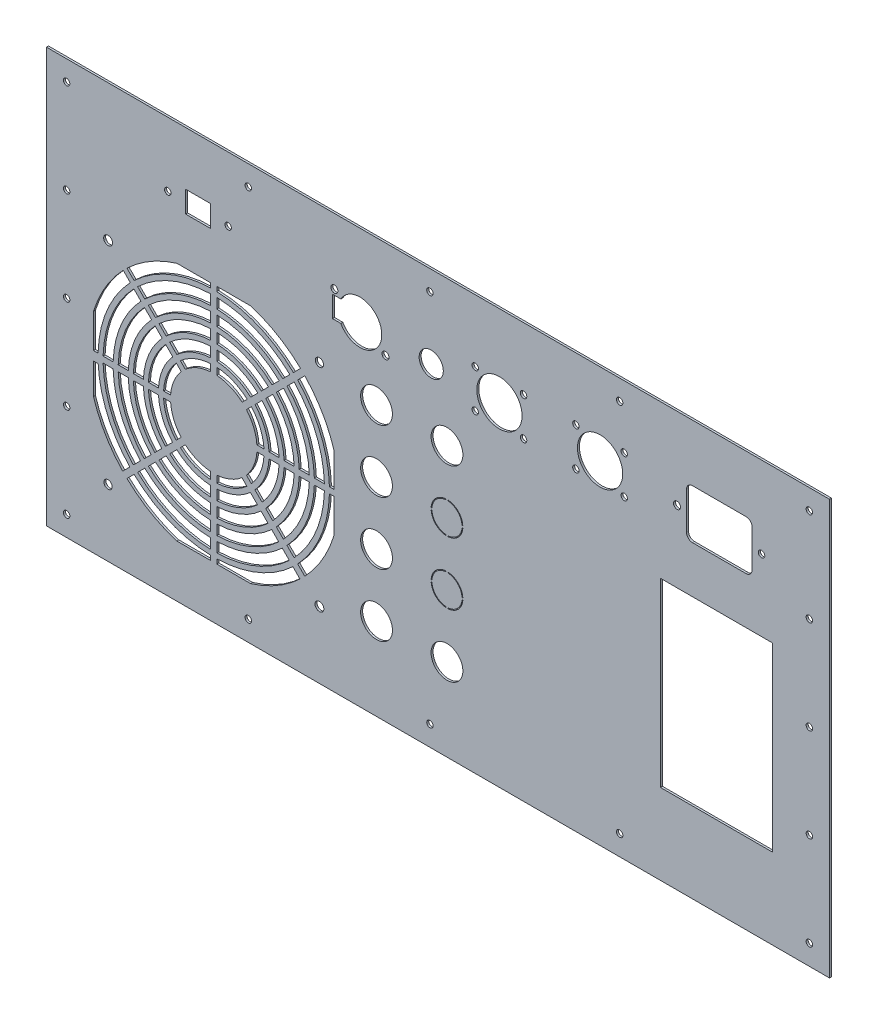
from build123d import *

# Parameters (mm, degrees)
SZKIC1_W                    = 397
SZKIC1_H                    = 206
DODANIE_WYCI_GNI_CIE1_DEPTH = 1
SZKIC2_R                    = 2.2
SZKIC2_R_2                  = 2.047520336
WYTNIJ_WYCI_GNI_CIE1_DEPTH  = 402.486583316
SZKIC3_R                    = 7.9
WYTNIJ_WYCI_GNI_CIE2_DEPTH  = 402.486583316
WYTNIJ_WYCI_GNI_CIE3_DEPTH  = 402.486583316
SZKIC5_R                    = 6
WYTNIJ_WYCI_GNI_CIE4_DEPTH  = 402.486583316
SZKIC7_R                    = 11.25
SZKIC7_R_2                  = 1.6
WYTNIJ_WYCI_GNI_CIE5_DEPTH  = 402.486583316
SZKIC10_R                   = 1.75
SZKIC10_R_2                 = 1.6
WYTNIJ_WYCI_GNI_CIE6_DEPTH  = 402.486583316
SZKIC11_W                   = 55.75
SZKIC11_H                   = 90
WYTNIJ_WYCI_GNI_CIE7_DEPTH  = 402.486583316
SZKIC12_R                   = 1.6
SZKIC12_W                   = 10.7
SZKIC12_H                   = 12.3
SZKIC12_W_2                 = 12.3
SZKIC12_H_2                 = 10.7
WYTNIJ_WYCI_GNI_CIE8_DEPTH  = 402.486583316
SZKIC13_R                   = 1.6
WYTNIJ_WYCI_GNI_CIE9_DEPTH  = 402.486583316
SZKIC14_W                   = 1
SZKIC14_H                   = 206
WYTNIJ_WYCI_GNI_CIE10_DEPTH = 8
DODANIE_WYCI_GNI_CIE2_START = -1
SZKIC15_R                   = 1.6
SZKIC15_W                   = 10.7
SZKIC15_H                   = 12.3
DODANIE_WYCI_GNI_CIE2_DEPTH = 1
SZKIC16_R                   = 1.75
WYTNIJ_WYCI_GNI_CIE11_DEPTH = 1
DODANIE_WYCI_GNI_CIE3_DEPTH = 1


with BuildPart() as part:
    # Szkic1 → Dodanie-wyciągnięcie1 (new body)
    with BuildSketch(Plane.XY):
        with Locations((-163.098523744, 71.461984995)):
            Rectangle(SZKIC1_W, SZKIC1_H)
    extrude(amount=DODANIE_WYCI_GNI_CIE1_DEPTH)

    # Szkic2 → Wytnij-wyciągnięcie1 (cut, through all)
    with BuildSketch(Plane.XY.offset(1)):
        with Locations((-323.009643383, 106.603512307)):
            Circle(SZKIC2_R)
        with Locations((-218.005397687, 106.607758003)):
            Circle(SZKIC2_R_2)
        with Locations((-218.009643383, 1.603512307)):
            Circle(SZKIC2_R)
        with Locations((-323.009643383, 1.603512307)):
            Circle(SZKIC2_R_2)
        with BuildLine():
            Line((-330.259643383, 72.438928855), (-330.259643383, 55.603512307))
            Line((-330.259643383, 55.603512307), (-327.990074836, 55.603512307))
            ThreePointArc((-327.990074836, 55.603512307), (-323.561956957, 76.277867416), (-311.960649805, 93.954033841))
            Line((-311.960649805, 93.954033841), (-315.474560497, 97.513260393))
            ThreePointArc((-315.474560497, 97.513260393), (-324.347213834, 85.848842797), (-330.259643383, 72.438928855))
        make_face()
        with BuildLine():
            Line((-272.009643383, 113.853512307), (-288.845059931, 113.853512307))
            ThreePointArc((-288.845059931, 113.853512307), (-302.082351584, 108.042497251), (-313.63042728, 99.345616547))
            Line((-313.63042728, 99.345616547), (-310.093786077, 95.808975344))
            ThreePointArc((-310.093786077, 95.808975344), (-292.513940744, 107.226585426), (-272.009643383, 111.583943759))
            Line((-272.009643383, 111.583943759), (-272.009643383, 113.853512307))
        make_face()
        with BuildLine():
            Line((-210.759643383, 72.438928855), (-210.759643383, 55.603512307))
            Line((-210.759643383, 55.603512307), (-213.02921193, 55.603512307))
            ThreePointArc((-213.02921193, 55.603512307), (-217.386570264, 76.107809668), (-228.804180346, 93.687655001))
            Line((-228.804180346, 93.687655001), (-225.267539143, 97.224296204))
            ThreePointArc((-225.267539143, 97.224296204), (-216.570658438, 85.676220507), (-210.759643383, 72.438928855))
        make_face()
        with BuildLine():
            Line((-330.259643383, 51.103512307), (-327.931329182, 51.103512307))
            ThreePointArc((-327.931329182, 51.103512307), (-323.340957803, 31.407648879), (-312.215106421, 14.519369613))
            Line((-312.215106421, 14.519369613), (-315.751747624, 10.98272841))
            ThreePointArc((-315.751747624, 10.98272841), (-324.448628328, 22.530804106), (-330.259643383, 35.768095758))
            Line((-330.259643383, 35.768095758), (-330.259643383, 51.103512307))
        make_face()
        with BuildLine():
            Line((-269.009643383, 113.853512307), (-269.009643383, 111.583943759))
            ThreePointArc((-269.009643383, 111.583943759), (-248.505346022, 107.226585426), (-230.925500689, 95.808975344))
            Line((-230.925500689, 95.808975344), (-227.388859486, 99.345616547))
            ThreePointArc((-227.388859486, 99.345616547), (-238.936935182, 108.042497251), (-252.174226835, 113.853512307))
            Line((-252.174226835, 113.853512307), (-269.009643383, 113.853512307))
        make_face()
        with BuildLine():
            Line((-210.759643383, 35.768095758), (-210.759643383, 52.603512307))
            Line((-210.759643383, 52.603512307), (-213.02921193, 52.603512307))
            ThreePointArc((-213.02921193, 52.603512307), (-217.386570264, 32.099214946), (-228.804180346, 14.519369613))
            Line((-228.804180346, 14.519369613), (-225.267539143, 10.98272841))
            ThreePointArc((-225.267539143, 10.98272841), (-216.570658438, 22.530804106), (-210.759643383, 35.768095758))
        make_face()
        with BuildLine():
            Line((-252.174226835, -5.646487693), (-269.009643383, -5.646487693))
            Line((-269.009643383, -5.646487693), (-269.009643383, -3.376919146))
            ThreePointArc((-269.009643383, -3.376919146), (-248.675629564, 0.910224755), (-231.193504271, 12.145304465))
            Line((-231.193504271, 12.145304465), (-227.679593579, 8.586077913))
            ThreePointArc((-227.679593579, 8.586077913), (-239.10988145, 0.063666354), (-252.174226835, -5.646487693))
        make_face()
        with BuildLine():
            Line((-272.009643383, -5.646487693), (-288.845059931, -5.646487693))
            ThreePointArc((-288.845059931, -5.646487693), (-302.082351584, 0.164527362), (-313.63042728, 8.861408066))
            Line((-313.63042728, 8.861408066), (-310.093786077, 12.398049269))
            ThreePointArc((-310.093786077, 12.398049269), (-292.513940744, 0.980439187), (-272.009643383, -3.376919146))
            Line((-272.009643383, -3.376919146), (-272.009643383, -5.646487693))
        make_face()
        with BuildLine():
            Line((-272.009643383, 32.655901717), (-272.009643383, 29.14855288))
            ThreePointArc((-272.009643383, 29.14855288), (-280.076729192, 31.006523994), (-287.094804246, 35.3970311))
            Line((-287.094804246, 35.3970311), (-284.614734099, 37.877101247))
            ThreePointArc((-284.614734099, 37.877101247), (-278.737337179, 34.240102358), (-272.009643383, 32.655901717))
        make_face()
        with BuildLine():
            Line((-269.009643383, 32.655901717), (-269.009643383, 29.14855288))
            ThreePointArc((-269.009643383, 29.14855288), (-261.016593896, 30.97599598), (-254.044668278, 35.29116012))
            Line((-254.044668278, 35.29116012), (-256.508798651, 37.787068246))
            ThreePointArc((-256.508798651, 37.787068246), (-262.345620825, 34.213848266), (-269.009643383, 32.655901717))
        make_face()
        with BuildLine():
            Line((-269.009643383, 26.644451871), (-269.009643383, 21.638146145))
            ThreePointArc((-269.009643383, 21.638146145), (-258.16867905, 24.037741082), (-248.768141133, 29.946586179))
            Line((-248.768141133, 29.946586179), (-252.285381809, 33.509185659))
            ThreePointArc((-252.285381809, 33.509185659), (-260.067288948, 28.663244347), (-269.009643383, 26.644451871))
        make_face()
        with BuildLine():
            Line((-272.009643383, 79.058471733), (-272.009643383, 75.551122896))
            ThreePointArc((-272.009643383, 75.551122896), (-278.737337179, 73.966922256), (-284.614734099, 70.329923366))
            Line((-284.614734099, 70.329923366), (-287.094804246, 72.809993513))
            ThreePointArc((-287.094804246, 72.809993513), (-280.076729192, 77.200500619), (-272.009643383, 79.058471733))
        make_face()
        with BuildLine():
            Line((-272.009643383, 26.644451871), (-272.009643383, 21.638146145))
            ThreePointArc((-272.009643383, 21.638146145), (-282.946854935, 24.0774275), (-292.405463778, 30.086371568))
            Line((-292.405463778, 30.086371568), (-288.86547105, 33.626364296))
            ThreePointArc((-288.86547105, 33.626364296), (-281.033437773, 28.696825162), (-272.009643383, 26.644451871))
        make_face()
        with BuildLine():
            Line((-272.009643383, 19.135669937), (-272.009643383, 14.131647201))
            ThreePointArc((-272.009643383, 14.131647201), (-285.816980678, 17.148331006), (-297.713360084, 24.778475262))
            Line((-297.713360084, 24.778475262), (-294.174981675, 28.316853672))
            ThreePointArc((-294.174981675, 28.316853672), (-283.903563516, 21.767728669), (-272.009643383, 19.135669937))
        make_face()
        with BuildLine():
            Line((-269.009643383, 19.135669937), (-269.009643383, 14.131647201))
            ThreePointArc((-269.009643383, 14.131647201), (-255.320764204, 17.099486184), (-243.494359454, 24.604793111))
            Line((-243.494359454, 24.604793111), (-247.009996187, 28.165767962))
            ThreePointArc((-247.009996187, 28.165767962), (-257.219374102, 21.724989449), (-269.009643383, 19.135669937))
        make_face()
        with BuildLine():
            Line((-272.009643383, 11.629991143), (-272.009643383, 6.627202425))
            ThreePointArc((-272.009643383, 6.627202425), (-288.687106421, 10.219234512), (-303.019803875, 19.472031472))
            Line((-303.019803875, 19.472031472), (-299.482298047, 23.009537299))
            ThreePointArc((-299.482298047, 23.009537299), (-286.773689259, 14.838632175), (-272.009643383, 11.629991143))
        make_face()
        with BuildLine():
            Line((-269.009643383, 11.629991143), (-269.009643383, 6.627202425))
            ThreePointArc((-269.009643383, 6.627202425), (-252.472849358, 10.161231286), (-238.222020954, 19.264461833))
            Line((-238.222020954, 19.264461833), (-241.736790714, 22.824558531))
            ThreePointArc((-241.736790714, 22.824558531), (-254.371459256, 14.786734551), (-269.009643383, 11.629991143))
        make_face()
        with BuildLine():
            Line((-272.009643383, 4.126017371), (-272.009643383, -0.876029343))
            ThreePointArc((-272.009643383, -0.876029343), (-291.557232163, 3.290138018), (-308.325389938, 14.166445408))
            Line((-308.325389938, 14.166445408), (-304.788408787, 17.703426559))
            ThreePointArc((-304.788408787, 17.703426559), (-289.643815001, 7.909535681), (-272.009643383, 4.126017371))
        make_face()
        with BuildLine():
            Line((-269.009643383, 4.126017371), (-269.009643383, -0.876029343))
            ThreePointArc((-269.009643383, -0.876029343), (-249.624934512, 3.222976388), (-232.950534669, 13.92499376))
            Line((-232.950534669, 13.92499376), (-236.464783125, 17.484562431))
            ThreePointArc((-236.464783125, 17.484562431), (-251.52354441, 7.848479653), (-269.009643383, 4.126017371))
        make_face()
        with BuildLine():
            Line((-269.009643383, 79.058471733), (-269.009643383, 75.551122896))
            ThreePointArc((-269.009643383, 75.551122896), (-262.281949587, 73.966922256), (-256.404552667, 70.329923366))
            Line((-256.404552667, 70.329923366), (-253.92448252, 72.809993513))
            ThreePointArc((-253.92448252, 72.809993513), (-260.942557574, 77.200500619), (-269.009643383, 79.058471733))
        make_face()
        with BuildLine():
            Line((-272.009643383, 109.083053956), (-272.009643383, 104.081007242))
            ThreePointArc((-272.009643383, 104.081007242), (-289.643815001, 100.297488932), (-304.788408787, 90.503598054))
            Line((-304.788408787, 90.503598054), (-308.325389938, 94.040579205))
            ThreePointArc((-308.325389938, 94.040579205), (-291.557232163, 104.916886595), (-272.009643383, 109.083053956))
        make_face()
        with BuildLine():
            Line((-269.009643383, 109.083053956), (-269.009643383, 104.081007242))
            ThreePointArc((-269.009643383, 104.081007242), (-251.375471765, 100.297488932), (-236.23087798, 90.503598054))
            Line((-236.23087798, 90.503598054), (-232.693896828, 94.040579205))
            ThreePointArc((-232.693896828, 94.040579205), (-249.462054603, 104.916886595), (-269.009643383, 109.083053956))
        make_face()
        with BuildLine():
            Line((-272.009643383, 101.579822188), (-272.009643383, 96.57703347))
            ThreePointArc((-272.009643383, 96.57703347), (-286.773689259, 93.368392438), (-299.482298047, 85.197487314))
            Line((-299.482298047, 85.197487314), (-303.019803875, 88.734993142))
            ThreePointArc((-303.019803875, 88.734993142), (-288.687106421, 97.987790101), (-272.009643383, 101.579822188))
        make_face()
        with BuildLine():
            Line((-269.009643383, 101.579822188), (-269.009643383, 96.57703347))
            ThreePointArc((-269.009643383, 96.57703347), (-254.245597508, 93.368392438), (-241.53698872, 85.197487314))
            Line((-241.53698872, 85.197487314), (-237.999482892, 88.734993142))
            ThreePointArc((-237.999482892, 88.734993142), (-252.332180346, 97.987790101), (-269.009643383, 101.579822188))
        make_face()
        with BuildLine():
            Line((-272.009643383, 94.075377412), (-272.009643383, 89.071354676))
            ThreePointArc((-272.009643383, 89.071354676), (-283.903563516, 86.439295944), (-294.174981675, 79.890170941))
            Line((-294.174981675, 79.890170941), (-297.713360084, 83.428549351))
            ThreePointArc((-297.713360084, 83.428549351), (-285.816980678, 91.058693607), (-272.009643383, 94.075377412))
        make_face()
        with BuildLine():
            Line((-269.009643383, 94.075377412), (-269.009643383, 89.071354676))
            ThreePointArc((-269.009643383, 89.071354676), (-257.11572325, 86.439295944), (-246.844305092, 79.890170941))
            Line((-246.844305092, 79.890170941), (-243.305926682, 83.428549351))
            ThreePointArc((-243.305926682, 83.428549351), (-255.202306089, 91.058693607), (-269.009643383, 94.075377412))
        make_face()
        with BuildLine():
            Line((-272.009643383, 86.568878468), (-272.009643383, 81.562572742))
            ThreePointArc((-272.009643383, 81.562572742), (-281.033437773, 79.510199451), (-288.86547105, 74.580660317))
            Line((-288.86547105, 74.580660317), (-292.405463778, 78.120653045))
            ThreePointArc((-292.405463778, 78.120653045), (-282.946854935, 84.129597113), (-272.009643383, 86.568878468))
        make_face()
        with BuildLine():
            Line((-269.009643383, 86.568878468), (-269.009643383, 81.562572742))
            ThreePointArc((-269.009643383, 81.562572742), (-259.985848993, 79.510199451), (-252.153815716, 74.580660317))
            Line((-252.153815716, 74.580660317), (-248.613822988, 78.120653045))
            ThreePointArc((-248.613822988, 78.120653045), (-258.072431831, 84.129597113), (-269.009643383, 86.568878468))
        make_face()
        with BuildLine():
            Line((-320.487138318, 55.603512307), (-325.489185033, 55.603512307))
            ThreePointArc((-325.489185033, 55.603512307), (-321.255334627, 75.31376502), (-310.203619407, 92.174344546))
            Line((-310.203619407, 92.174344546), (-306.689370951, 88.614775875))
            ThreePointArc((-306.689370951, 88.614775875), (-316.642089969, 73.385560227), (-320.487138318, 55.603512307))
        make_face()
        with BuildLine():
            Line((-320.487138318, 52.603512307), (-325.489185033, 52.603512307))
            ThreePointArc((-325.489185033, 52.603512307), (-321.323017671, 33.055923526), (-310.446710282, 16.287765751))
            Line((-310.446710282, 16.287765751), (-306.90972913, 19.824746903))
            ThreePointArc((-306.90972913, 19.824746903), (-316.703620009, 34.969340688), (-320.487138318, 52.603512307))
        make_face()
        with BuildLine():
            Line((-312.983164546, 55.603512307), (-317.985953265, 55.603512307))
            ThreePointArc((-317.985953265, 55.603512307), (-314.33546764, 72.421457831), (-304.932133122, 86.834876473))
            Line((-304.932133122, 86.834876473), (-301.417363362, 83.274779775))
            ThreePointArc((-301.417363362, 83.274779775), (-309.722222981, 70.493253039), (-312.983164546, 55.603512307))
        make_face()
        with BuildLine():
            Line((-312.983164546, 52.603512307), (-317.985953265, 52.603512307))
            ThreePointArc((-317.985953265, 52.603512307), (-314.393921177, 35.926049269), (-305.141124218, 21.593351815))
            Line((-305.141124218, 21.593351815), (-301.60361839, 25.130857643))
            ThreePointArc((-301.60361839, 25.130857643), (-309.774523515, 37.839466431), (-312.983164546, 52.603512307))
        make_face()
        with BuildLine():
            Line((-305.477485753, 55.603512307), (-310.481508489, 55.603512307))
            ThreePointArc((-310.481508489, 55.603512307), (-307.415600652, 69.529150643), (-299.659794623, 81.494545195))
            Line((-299.659794623, 81.494545195), (-296.144157889, 77.933570343))
            ThreePointArc((-296.144157889, 77.933570343), (-302.802355993, 67.600945851), (-305.477485753, 55.603512307))
        make_face()
        with BuildLine():
            Line((-305.477485753, 52.603512307), (-310.481508489, 52.603512307))
            ThreePointArc((-310.481508489, 52.603512307), (-307.464824684, 38.796175012), (-299.834680428, 26.899795606))
            Line((-299.834680428, 26.899795606), (-296.296302018, 30.438174015))
            ThreePointArc((-296.296302018, 30.438174015), (-302.845427021, 40.709592174), (-305.477485753, 52.603512307))
        make_face()
        with BuildLine():
            Line((-297.968703819, 55.603512307), (-302.975009545, 55.603512307))
            ThreePointArc((-302.975009545, 55.603512307), (-300.495733664, 66.636843455), (-294.386012943, 76.152752127))
            Line((-294.386012943, 76.152752127), (-290.868772267, 72.590152647))
            ThreePointArc((-290.868772267, 72.590152647), (-295.882489005, 64.708638663), (-297.968703819, 55.603512307))
        make_face()
        with BuildLine():
            Line((-297.968703819, 52.603512307), (-302.975009545, 52.603512307))
            ThreePointArc((-302.975009545, 52.603512307), (-300.53572819, 41.666300755), (-294.526784121, 32.207691912))
            Line((-294.526784121, 32.207691912), (-290.986791394, 35.747684639))
            ThreePointArc((-290.986791394, 35.747684639), (-295.916330527, 43.579717917), (-297.968703819, 52.603512307))
        make_face()
        with BuildLine():
            Line((-291.957253973, 52.603512307), (-295.46460281, 52.603512307))
            ThreePointArc((-295.46460281, 52.603512307), (-293.606631696, 44.536426497), (-289.21612459, 37.518351443))
            Line((-289.21612459, 37.518351443), (-286.736054443, 39.99842159))
            ThreePointArc((-286.736054443, 39.99842159), (-290.373053332, 45.875818511), (-291.957253973, 52.603512307))
        make_face()
        with BuildLine():
            Line((-291.957253973, 55.603512307), (-295.46460281, 55.603512307))
            ThreePointArc((-295.46460281, 55.603512307), (-293.575866676, 63.744536267), (-289.109485798, 70.808178186))
            Line((-289.109485798, 70.808178186), (-286.645355425, 68.31227006))
            ThreePointArc((-286.645355425, 68.31227006), (-290.346595415, 62.394792913), (-291.957253973, 55.603512307))
        make_face()
        with BuildLine():
            Line((-245.554683956, 52.603512307), (-249.062032794, 52.603512307))
            ThreePointArc((-249.062032794, 52.603512307), (-250.646233434, 45.875818511), (-254.283232323, 39.99842159))
            Line((-254.283232323, 39.99842159), (-251.803162176, 37.518351443))
            ThreePointArc((-251.803162176, 37.518351443), (-247.41265507, 44.536426497), (-245.554683956, 52.603512307))
        make_face()
        with BuildLine():
            Line((-245.554683956, 55.603512307), (-249.062032794, 55.603512307))
            ThreePointArc((-249.062032794, 55.603512307), (-250.646233434, 62.331206102), (-254.283232323, 68.208603023))
            Line((-254.283232323, 68.208603023), (-251.803162176, 70.68867317))
            ThreePointArc((-251.803162176, 70.68867317), (-247.41265507, 63.670598116), (-245.554683956, 55.603512307))
        make_face()
        with BuildLine():
            Line((-238.044277222, 55.603512307), (-243.050582948, 55.603512307))
            ThreePointArc((-243.050582948, 55.603512307), (-245.102956239, 64.627306697), (-250.032495372, 72.459339974))
            Line((-250.032495372, 72.459339974), (-246.492502645, 75.999332701))
            ThreePointArc((-246.492502645, 75.999332701), (-240.483558577, 66.540723858), (-238.044277222, 55.603512307))
        make_face()
        with BuildLine():
            Line((-238.044277222, 52.603512307), (-243.050582948, 52.603512307))
            ThreePointArc((-243.050582948, 52.603512307), (-245.102956239, 43.579717917), (-250.032495372, 35.747684639))
            Line((-250.032495372, 35.747684639), (-246.492502645, 32.207691912))
            ThreePointArc((-246.492502645, 32.207691912), (-240.483558577, 41.666300755), (-238.044277222, 52.603512307))
        make_face()
        with BuildLine():
            Line((-230.537778278, 52.603512307), (-235.541801013, 52.603512307))
            ThreePointArc((-235.541801013, 52.603512307), (-238.173859745, 40.709592174), (-244.722984748, 30.438174015))
            Line((-244.722984748, 30.438174015), (-241.184606339, 26.899795606))
            ThreePointArc((-241.184606339, 26.899795606), (-233.554462083, 38.796175012), (-230.537778278, 52.603512307))
        make_face()
        with BuildLine():
            Line((-230.537778278, 55.603512307), (-235.541801013, 55.603512307))
            ThreePointArc((-235.541801013, 55.603512307), (-238.173859745, 67.497432439), (-244.722984748, 77.768850598))
            Line((-244.722984748, 77.768850598), (-241.184606339, 81.307229007))
            ThreePointArc((-241.184606339, 81.307229007), (-233.554462083, 69.410849601), (-230.537778278, 55.603512307))
        make_face()
        with BuildLine():
            Line((-223.033333501, 52.603512307), (-228.03612222, 52.603512307))
            ThreePointArc((-228.03612222, 52.603512307), (-231.244763251, 37.839466431), (-239.415668376, 25.130857643))
            Line((-239.415668376, 25.130857643), (-235.878162548, 21.593351815))
            ThreePointArc((-235.878162548, 21.593351815), (-226.625365589, 35.926049269), (-223.033333501, 52.603512307))
        make_face()
        with BuildLine():
            Line((-223.033333501, 55.603512307), (-228.03612222, 55.603512307))
            ThreePointArc((-228.03612222, 55.603512307), (-231.244763251, 70.367558182), (-239.415668376, 83.07616697))
            Line((-239.415668376, 83.07616697), (-235.878162548, 86.613672798))
            ThreePointArc((-235.878162548, 86.613672798), (-226.625365589, 72.280975344), (-223.033333501, 55.603512307))
        make_face()
        with BuildLine():
            Line((-215.530101734, 52.603512307), (-220.532148448, 52.603512307))
            ThreePointArc((-220.532148448, 52.603512307), (-224.315666758, 34.969340688), (-234.109557636, 19.824746903))
            Line((-234.109557636, 19.824746903), (-230.572576484, 16.287765751))
            ThreePointArc((-230.572576484, 16.287765751), (-219.696269095, 33.055923526), (-215.530101734, 52.603512307))
        make_face()
        with BuildLine():
            Line((-215.530101734, 55.603512307), (-220.532148448, 55.603512307))
            ThreePointArc((-220.532148448, 55.603512307), (-224.315666758, 73.237683925), (-234.109557636, 88.38227771))
            Line((-234.109557636, 88.38227771), (-230.572576484, 91.919258862))
            ThreePointArc((-230.572576484, 91.919258862), (-219.696269095, 75.151101087), (-215.530101734, 55.603512307))
        make_face()
    extrude(amount=-WYTNIJ_WYCI_GNI_CIE1_DEPTH, mode=Mode.SUBTRACT)

    # Szkic3 → Wytnij-wyciągnięcie2 (cut, through all)
    with BuildSketch(Plane(origin=(0, 0, 0), x_dir=(-1, 0, 0), z_dir=(0, 0, -1))):
        with Locations((189.633110243, 40.461984995)):
            Circle(SZKIC3_R)
        with Locations((189.633110243, 9.461984995)):
            Circle(SZKIC3_R)
        with Locations((154.633110243, 71.461984995)):
            Circle(SZKIC3_R)
        with Locations((189.633110243, 71.461984995)):
            Circle(SZKIC3_R)
        with Locations((154.633110243, 9.461984995)):
            Circle(SZKIC3_R)
        with Locations((154.633110243, 40.461984995)):
            Circle(SZKIC3_R)
        with Locations((154.633110243, 102.461984995)):
            Circle(SZKIC3_R)
        with Locations((189.633110243, 102.461984995)):
            Circle(SZKIC3_R)
    extrude(amount=-WYTNIJ_WYCI_GNI_CIE2_DEPTH, mode=Mode.SUBTRACT)

    # Szkic4 → Wytnij-wyciągnięcie3 (cut, through all)
    with BuildSketch(Plane(origin=(0, 0, 0), x_dir=(-1, 0, 0), z_dir=(0, 0, -1))):
        with BuildLine():
            Line((207.378372219, 139.211984957), (211.483110243, 139.211984957))
            Line((211.483110243, 139.211984957), (211.483110243, 128.711984957))
            Line((211.483110243, 128.711984957), (207.378372219, 128.711984957))
            ThreePointArc((207.378372219, 128.711984957), (187.033110243, 133.961984957), (207.378372219, 139.211984957))
        make_face()
    extrude(amount=-WYTNIJ_WYCI_GNI_CIE3_DEPTH, mode=Mode.SUBTRACT)

    # Szkic5 → Wytnij-wyciągnięcie4 (cut, through all)
    with BuildSketch(Plane(origin=(0, 0, 0), x_dir=(-1, 0, 0), z_dir=(0, 0, -1))):
        with Locations((162.463329086, 133.692146056)):
            Circle(SZKIC5_R)
    extrude(amount=-WYTNIJ_WYCI_GNI_CIE4_DEPTH, mode=Mode.SUBTRACT)

    # Szkic7 → Wytnij-wyciągnięcie5 (cut, through all)
    with BuildSketch(Plane(origin=(0, 0, 0), x_dir=(-1, 0, 0), z_dir=(0, 0, -1))):
        with Locations((128.57994213, 133.961858881)):
            Circle(SZKIC7_R)
        with Locations((78.57987055, 133.961984995)):
            Circle(SZKIC7_R)
        with Locations((140.57994213, 143.461858881)):
            Circle(SZKIC7_R_2)
        with Locations((140.57994213, 124.461858881)):
            Circle(SZKIC7_R_2)
        with Locations((116.57994213, 124.461858881)):
            Circle(SZKIC7_R_2)
        with Locations((116.57994213, 143.461858881)):
            Circle(SZKIC7_R_2)
        with Locations((90.57987055, 143.461858881)):
            Circle(SZKIC7_R_2)
        with Locations((90.57987055, 124.461858881)):
            Circle(SZKIC7_R_2)
        with Locations((66.57987055, 124.461858881)):
            Circle(SZKIC7_R_2)
        with Locations((66.57987055, 143.461858881)):
            Circle(SZKIC7_R_2)
    extrude(amount=-WYTNIJ_WYCI_GNI_CIE5_DEPTH, mode=Mode.SUBTRACT)

    # Szkic10 → Wytnij-wyciągnięcie6 (cut, through all)
    with BuildSketch(Plane(origin=(0, 0, 0), x_dir=(-1, 0, 0), z_dir=(0, 0, -1))):
        with Locations((40.348523744, 133.991984995)):
            Circle(SZKIC10_R)
        with Locations((-1.651476256, 133.991984995)):
            Circle(SZKIC10_R_2)
        with BuildLine():
            Line((32.648523744, 146.241984995), (6.048523744, 146.241984995))
            ThreePointArc((6.048523744, 146.241984995), (3.927203401, 145.363305339), (3.048523744, 143.241984995))
            Line((3.048523744, 143.241984995), (3.048523744, 124.741984995))
            ThreePointArc((3.048523744, 124.741984995), (3.927203401, 122.620664652), (6.048523744, 121.741984995))
            Line((6.048523744, 121.741984995), (32.648523744, 121.741984995))
            ThreePointArc((32.648523744, 121.741984995), (34.769844088, 122.620664652), (35.648523744, 124.741984995))
            Line((35.648523744, 124.741984995), (35.648523744, 143.241984995))
            ThreePointArc((35.648523744, 143.241984995), (34.769844088, 145.363305339), (32.648523744, 146.241984995))
        make_face()
    extrude(amount=-WYTNIJ_WYCI_GNI_CIE6_DEPTH, mode=Mode.SUBTRACT)

    # Szkic11 → Wytnij-wyciągnięcie7 (cut, through all)
    with BuildSketch(Plane.XY.offset(1)):
        with Locations((-20.723523744, 53.461984995)):
            Rectangle(SZKIC11_W, SZKIC11_H)
    extrude(amount=-WYTNIJ_WYCI_GNI_CIE7_DEPTH, mode=Mode.SUBTRACT)

    # Szkic12 → Wytnij-wyciągnięcie8 (cut, through all)
    with BuildSketch(Plane.XY.offset(1)):
        with Locations((-119.473523744, 59.586984995)):
            Circle(SZKIC12_R)
        with Locations((-119.473523744, 29.586984995)):
            Circle(SZKIC12_R)
        with Locations((-293.357475742, 142.550530727)):
            Circle(SZKIC12_R)
        with Locations((-263.357475742, 142.550530727)):
            Circle(SZKIC12_R)
        with Locations((-119.473523744, 44.586984995)):
            Rectangle(SZKIC12_W, SZKIC12_H)
        with Locations((-278.357475742, 142.550530727)):
            Rectangle(SZKIC12_W_2, SZKIC12_H_2)
    extrude(amount=-WYTNIJ_WYCI_GNI_CIE8_DEPTH, mode=Mode.SUBTRACT)

    # Szkic13 → Wytnij-wyciągnięcie9 (cut, through all)
    with BuildSketch(Plane(origin=(0, 0, 0), x_dir=(-1, 0, 0), z_dir=(0, 0, -1))):
        with Locations((343.598523744, 24.961984995)):
            Circle(SZKIC13_R)
        with Locations(Location((343.598523744, 117.961984995, 0), (0, 0, 180))):
            Circle(SZKIC13_R)
        with Locations((-25.401476256, 24.961984995)):
            Circle(SZKIC13_R)
        with Locations(Location((-25.401476256, 117.961984995, 0), (0, 0, 180))):
            Circle(SZKIC13_R)
        with Locations((253.348523744, -21.538015005)):
            Circle(SZKIC13_R)
        with Locations((343.598523744, 71.461984995)):
            Circle(SZKIC13_R)
        with Locations((343.598523744, -21.538015005)):
            Circle(SZKIC13_R)
        with Locations(Location((-25.401476256, -21.538015005, 0), (0, 0, 180))):
            Circle(SZKIC13_R)
        with Locations(Location((-25.401476256, 71.461984995, 0), (0, 0, 180))):
            Circle(SZKIC13_R)
        with Locations((-25.401476256, 164.461984995)):
            Circle(SZKIC13_R)
        with Locations(Location((343.598523744, 164.461984995, 0), (0, 0, 180))):
            Circle(SZKIC13_R)
        with Locations((253.348523744, 164.461984995)):
            Circle(SZKIC13_R)
        with Locations((163.098523744, -21.538015005)):
            Circle(SZKIC13_R)
        with Locations((163.098523744, 164.461984995)):
            Circle(SZKIC13_R)
        with Locations((68.848523744, 164.461984995)):
            Circle(SZKIC13_R)
        with Locations((68.848523744, -21.538015005)):
            Circle(SZKIC13_R)
    extrude(amount=-WYTNIJ_WYCI_GNI_CIE9_DEPTH, mode=Mode.SUBTRACT)

    # Szkic14 → Wytnij-wyciągnięcie10 (cut)
    with BuildSketch(Plane.ZY.offset(361.598523744)):
        with Locations((0.5, 71.461984995)):
            Rectangle(SZKIC14_W, SZKIC14_H)
    extrude(amount=-WYTNIJ_WYCI_GNI_CIE10_DEPTH, mode=Mode.SUBTRACT)

    # Szkic15 → Dodanie-wyciągnięcie2 (add)
    with BuildSketch(Plane(origin=(0, 0, 0), x_dir=(-1, 0, 0), z_dir=(0, 0, -1)).offset(DODANIE_WYCI_GNI_CIE2_START)):
        with Locations((119.473523744, 59.586984995)):
            Circle(SZKIC15_R)
        with Locations((119.473523744, 29.586984995)):
            Circle(SZKIC15_R)
        with Locations((119.473523744, 44.586984995)):
            Rectangle(SZKIC15_W, SZKIC15_H)
    extrude(amount=DODANIE_WYCI_GNI_CIE2_DEPTH)

    # Szkic16 → Wytnij-wyciągnięcie11 (cut)
    with BuildSketch(Plane(origin=(0, 0, 0), x_dir=(-1, 0, 0), z_dir=(0, 0, -1))):
        with Locations((185.183110243, 126.024484957)):
            Circle(SZKIC16_R)
        with Locations((210.583110243, 141.899484957)):
            Circle(SZKIC16_R)
    extrude(amount=-WYTNIJ_WYCI_GNI_CIE11_DEPTH, mode=Mode.SUBTRACT)

    # Szkic17 → Dodanie-wyciągnięcie3 (add)
    with BuildSketch(Plane(origin=(0, 0, 0), x_dir=(-1, 0, 0), z_dir=(0, 0, -1))):
        with BuildLine():
            Line((155.133223413, 79.346139155), (155.133223413, 78.945292206))
            ThreePointArc((155.133223413, 78.945292206), (159.936500238, 76.765196716), (162.116434261, 71.961846607))
            Line((162.116434261, 71.961846607), (162.517280355, 71.961846607))
            ThreePointArc((162.517280355, 71.961846607), (162.533109791, 71.459315302), (162.516940712, 70.956794809))
            Line((162.516940712, 70.956794809), (162.116076424, 70.956794809))
            ThreePointArc((162.116076424, 70.956794809), (159.934611755, 66.1568854), (155.133223413, 63.978677784))
            Line((155.133223413, 63.978677784), (155.133223413, 63.577830835))
            ThreePointArc((155.133223413, 63.577830835), (154.633166941, 63.561984995), (154.133110243, 63.577823657))
            Line((154.133110243, 63.577823657), (154.133110243, 63.978670222))
            ThreePointArc((154.133110243, 63.978670222), (149.331648845, 66.156845313), (147.150144061, 70.956794809))
            Line((147.150144061, 70.956794809), (146.749279773, 70.956794809))
            ThreePointArc((146.749279773, 70.956794809), (146.733110694, 71.459315302), (146.74894013, 71.961846607))
            Line((146.74894013, 71.961846607), (147.149786224, 71.961846607))
            ThreePointArc((147.149786224, 71.961846607), (149.329760347, 76.765236817), (154.133110243, 78.945299769))
            Line((154.133110243, 78.945299769), (154.133110243, 79.346146333))
            ThreePointArc((154.133110243, 79.346146333), (154.633166941, 79.361984995), (155.133223413, 79.346139155))
        make_face()
        with BuildLine():
            Line((155.133223413, 48.346139155), (155.133223413, 47.945292206))
            ThreePointArc((155.133223413, 47.945292206), (159.936500238, 45.765196716), (162.116434261, 40.961846607))
            Line((162.116434261, 40.961846607), (162.517280355, 40.961846607))
            ThreePointArc((162.517280355, 40.961846607), (162.533109791, 40.459315302), (162.516940712, 39.956794809))
            Line((162.516940712, 39.956794809), (162.116076424, 39.956794809))
            ThreePointArc((162.116076424, 39.956794809), (159.934611755, 35.1568854), (155.133223413, 32.978677784))
            Line((155.133223413, 32.978677784), (155.133223413, 32.577830835))
            ThreePointArc((155.133223413, 32.577830835), (154.633166941, 32.561984995), (154.133110243, 32.577823657))
            Line((154.133110243, 32.577823657), (154.133110243, 32.978670222))
            ThreePointArc((154.133110243, 32.978670222), (149.331648845, 35.156845313), (147.150144061, 39.956794809))
            Line((147.150144061, 39.956794809), (146.749279773, 39.956794809))
            ThreePointArc((146.749279773, 39.956794809), (146.733110694, 40.459315302), (146.74894013, 40.961846607))
            Line((146.74894013, 40.961846607), (147.149786224, 40.961846607))
            ThreePointArc((147.149786224, 40.961846607), (149.329760347, 45.765236817), (154.133110243, 47.945299769))
            Line((154.133110243, 47.945299769), (154.133110243, 48.346146333))
            ThreePointArc((154.133110243, 48.346146333), (154.633166941, 48.361984995), (155.133223413, 48.346139155))
        make_face()
    extrude(amount=-DODANIE_WYCI_GNI_CIE3_DEPTH)


solid = part.part
